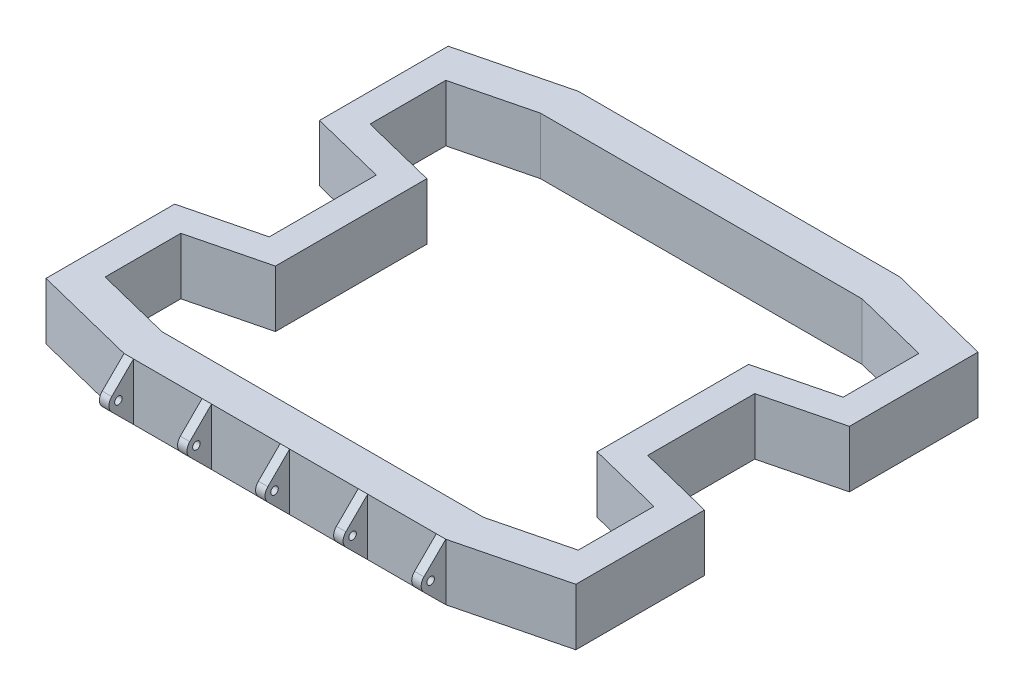
from build123d import *

# Parameters (mm, degrees)
BOSS_EXTRUDE1_DEPTH = 38.1
SKETCH2_R           = 2.54
BOSS_EXTRUDE2_DEPTH = 6.35
LPATTERN1_COUNT     = 5
LPATTERN1_PITCH     = 52.3875


with BuildPart() as part:
    # Sketch1 → Boss-Extrude1 (new body)
    with BuildSketch(Plane(origin=(0, 0, 0), x_dir=(1, 0, 0), z_dir=(0, 1, 0))):
        Polygon((-69.85, 175.626209458), (-19.05, 162.926209458), (-19.05, 91.073790542), (-69.85, 78.373790542), (-69.85, -7.9375), (0, -25.4), (215.9, -25.4), (285.75, -7.9375), (285.75, 78.373790542), (234.95, 91.073790542), (234.95, 162.926209458), (285.75, 175.626209458), (285.75, 261.9375), (215.9, 279.4), (0, 279.4), (-69.85, 261.9375), align=None)
        Polygon((0, 177.8), (0, 76.2), (-50.8, 63.5), (-50.8, 12.7), (0, 0), (215.9, 0), (266.7, 12.7), (266.7, 63.5), (215.9, 76.2), (215.9, 177.8), (266.7, 190.5), (266.7, 241.3), (215.9, 254), (0, 254), (-50.8, 241.3), (-50.8, 190.5), align=None, mode=Mode.SUBTRACT)
    extrude(amount=BOSS_EXTRUDE1_DEPTH)

    # Sketch2 → Boss-Extrude2 (add)
    with BuildSketch(Plane(origin=(0, 0, 0), x_dir=(0, 0, -1), z_dir=(1, 0, 0))):
        with BuildLine():
            Line((-40.036226007, 23.553987204), (-25.4, 38.1))
            Line((-25.4, 38.1), (-25.4, 0))
            Line((-25.4, 0), (-40.036226007, 14.546012796))
            ThreePointArc((-40.036226007, 14.546012796), (-41.91, 19.05), (-40.036226007, 23.553987204))
        make_face()
        with Locations((-35.56, 19.05)):
            Circle(SKETCH2_R, mode=Mode.SUBTRACT)
    boss_extrude2 = extrude(amount=BOSS_EXTRUDE2_DEPTH)

    # LPattern1: Boss-Extrude2 ×5
    with Locations(*[(i * LPATTERN1_PITCH, 0, 0) for i in range(1, LPATTERN1_COUNT)]):
        add(boss_extrude2)


solid = part.part
